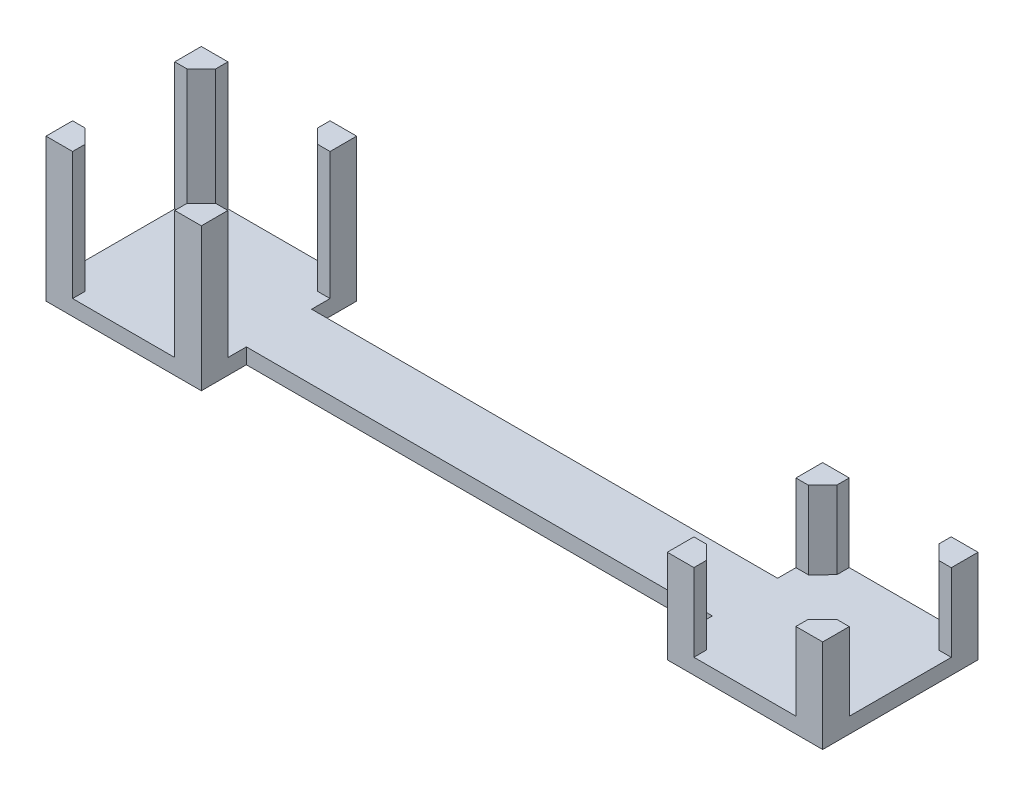
from build123d import *

# Parameters (mm, degrees)
BASE_EXTR_DEPTH                = 5
MOTOR_1_EXTR_DEPTH             = 41
SHAFT_MOTOR_SUPPORT_EXTR_DEPTH = 25


with BuildPart() as part:
    # Base_sch → base_extr (new body)
    with BuildSketch(Plane(origin=(0, 0, 0), x_dir=(1, 0, 0), z_dir=(0, 1, 0))):
        Polygon((25, 10.5), (25, 25), (-25, 25), (-25, -25), (25, -25), (25, -10.5), (175, -10.5), (175, -25), (225.013827764, -25), (225.013827764, 25), (175, 25), (175, 10.5), align=None)
    extrude(amount=BASE_EXTR_DEPTH)

    # motor_support_sch → Motor_1_extr (add)
    with BuildSketch(Plane(origin=(0, 5, 0), x_dir=(1, 0, 0), z_dir=(0, 1, 0))):
        Polygon((-25, 16.439389634), (-25, 25), (-16.439389634, 25), (-16.439389634, 21), (-18.719694817, 18.719694817), (-21, 16.439389634), align=None)
        Polygon((16.439389634, 25), (25, 25), (25, 16.439389634), (21, 16.439389634), (18.719694817, 18.719694817), (16.439389634, 21), align=None)
        Polygon((25, -16.439389634), (25, -25), (16.439389634, -25), (16.439389634, -21), (18.719694817, -18.719694817), (21, -16.439389634), align=None)
        Polygon((-18.719694817, -18.719694817), (-21, -16.439389634), (-25, -16.439389634), (-25, -25), (-16.439389634, -25), (-16.439389634, -21), align=None)
    extrude(amount=MOTOR_1_EXTR_DEPTH)

    # shaft_motor_support_sch → shaft_motor_support_extr (add)
    with BuildSketch(Plane(origin=(0, 5, 0), x_dir=(1, 0, 0), z_dir=(0, 1, 0))):
        Polygon((183.560610366, -21), (179, -16.439389634), (175, -16.439389634), (175, -25), (183.560610366, -25), align=None)
        Polygon((216.38573482, -21), (216.38573482, -25), (225.013827764, -25), (225.013827764, -16.439389634), (221.056642929, -16.439389634), align=None)
        Polygon((183.560610366, 25), (175, 25), (175, 16.402508948), (179, 16.402508948), (183.560610366, 21.024047525), align=None)
        Polygon((225.013827764, 25), (216.38573482, 25), (216.38573482, 21.024047525), (221.056642929, 16.402508948), (225.013827764, 16.402508948), align=None)
    extrude(amount=SHAFT_MOTOR_SUPPORT_EXTR_DEPTH)


solid = part.part
